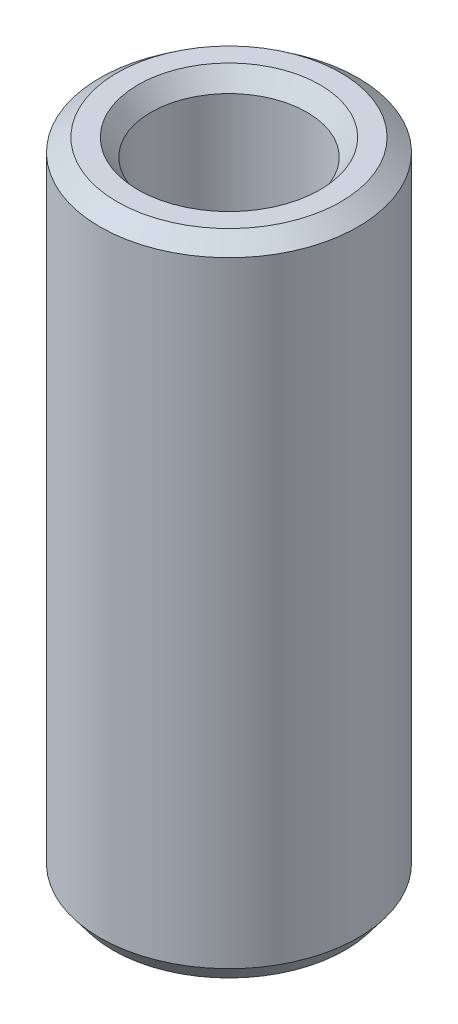
from build123d import *
from OCP.BRepFilletAPI import BRepFilletAPI_MakeChamfer

# Parameters (mm, degrees)
SKETCH1_R           = 30
BOSS_EXTRUDE1_DEPTH = 150.156553335
SKETCH2_R           = 18.124028588
CUT_EXTRUDE1_DEPTH  = 157.035222016
CHAMFER1_SIZE       = 3.032068775
CHAMFER1_SIZE2      = 4.012058741


with BuildPart() as part:
    # Sketch1 → Boss-Extrude1 (new body)
    with BuildSketch(Plane(origin=(0, 0, 0), x_dir=(1, 0, 0), z_dir=(0, 1, 0))):
        Circle(SKETCH1_R)
    extrude(amount=BOSS_EXTRUDE1_DEPTH)

    # Sketch2 → Cut-Extrude1 (cut, through all)
    with BuildSketch(Plane(origin=(0, 0, 0), x_dir=(1, 0, 0), z_dir=(0, 1, 0))):
        Circle(SKETCH2_R)
    extrude(amount=CUT_EXTRUDE1_DEPTH, mode=Mode.SUBTRACT)

    # Chamfer1: one chamfer whose edges measure the first distance from different faces: ONE call of the kernel's chamfer builder (chamfer() names one face for all edges)
    chamfer1_edges_1 = [part.edges().sort_by_distance(p)[0] for p in [
        (-18.124028588, 150.156553335, 0),
    ]]
    chamfer1_side_1 = [part.faces().sort_by_distance(p)[0] for p in [
        (-29.151471863, 150.156553335, 0),
    ]]
    chamfer1_edges_2 = [part.edges().sort_by_distance(p)[0] for p in [
        (-18.124028588, 0, 0),
    ]]
    chamfer1_side_2 = [part.faces().sort_by_distance(p)[0] for p in [
        (-18.124028588, 75.078276668, 0),
    ]]
    chamfer1_edges_3 = [part.edges().sort_by_distance(p)[0] for p in [
        (-30, 0, 0),
    ]]
    chamfer1_side_3 = [part.faces().sort_by_distance(p)[0] for p in [
        (-29.151471863, 0, 0),
    ]]
    chamfer1_edges_4 = [part.edges().sort_by_distance(p)[0] for p in [
        (-30, 150.156553335, 0),
    ]]
    chamfer1_side_4 = [part.faces().sort_by_distance(p)[0] for p in [
        (-30, 75.078276668, 0),
    ]]
    chamfer1 = BRepFilletAPI_MakeChamfer(part.part.solid().wrapped)
    for e in chamfer1_edges_1:
        chamfer1.Add(CHAMFER1_SIZE, CHAMFER1_SIZE2, e.wrapped, chamfer1_side_1[0].wrapped)  # the first distance lies on this face
    for e in chamfer1_edges_2:
        chamfer1.Add(CHAMFER1_SIZE, CHAMFER1_SIZE2, e.wrapped, chamfer1_side_2[0].wrapped)  # the first distance lies on this face
    for e in chamfer1_edges_3:
        chamfer1.Add(CHAMFER1_SIZE, CHAMFER1_SIZE2, e.wrapped, chamfer1_side_3[0].wrapped)  # the first distance lies on this face
    for e in chamfer1_edges_4:
        chamfer1.Add(CHAMFER1_SIZE, CHAMFER1_SIZE2, e.wrapped, chamfer1_side_4[0].wrapped)  # the first distance lies on this face
    add(Compound.cast(chamfer1.Shape()), mode=Mode.REPLACE)


solid = part.part
